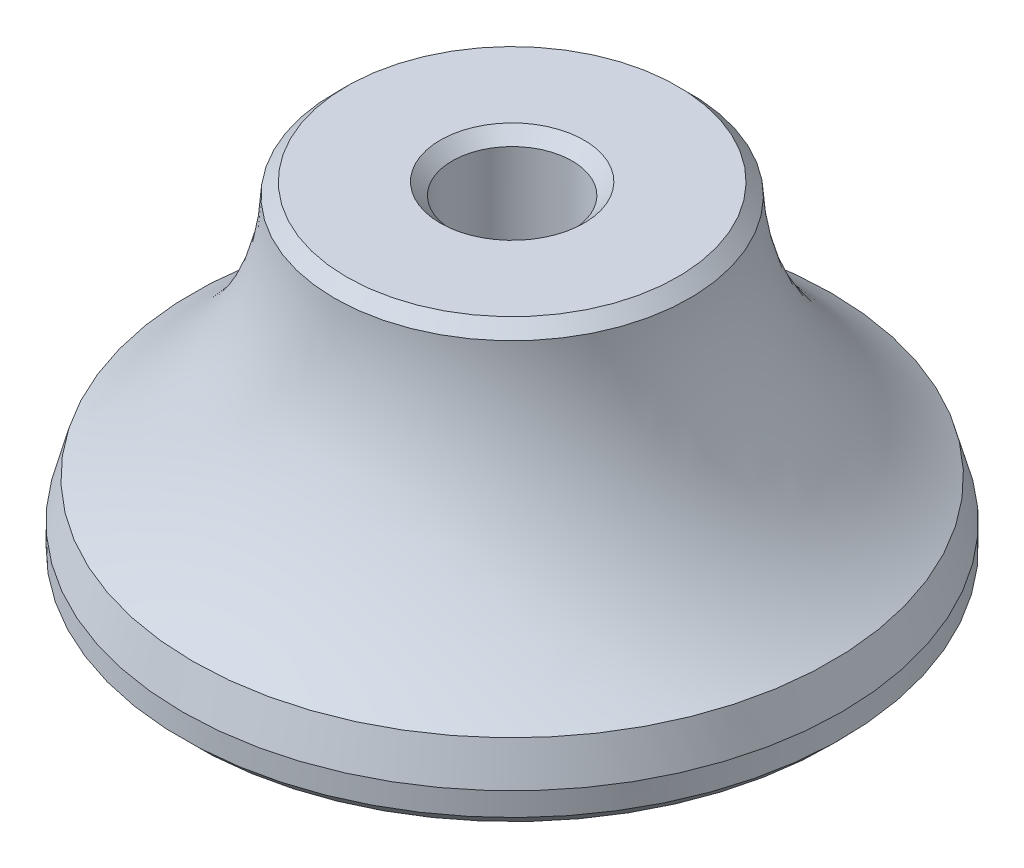
from build123d import *

# Parameters (mm, degrees)
CUT_EXTRUDE1_DEPTH      = 31.245937227
CUT_EXTRUDE1_DEPTH_BACK = 31.245937227
SKETCH2_R               = 3.175
CHAMFER1_SIZE           = 0.635
CHAMFER1_SIZE_2         = 1.705739105


with BuildPart() as part:
    # Sketch1 → Revolve1 (revolve)
    with BuildSketch(Plane.XY, mode=Mode.PRIVATE) as revolve1_sk:
        with BuildLine():
            Line((17.4625, -17.4625), (17.4625, -13.894606786))
            ThreePointArc((17.4625, -13.894606786), (11.560204499, -8.032687253), (9.398, 0))
            Line((9.398, 0), (0, 0))
            Line((0, 0), (0, -17.4625))
            Line((0, -17.4625), (17.4625, -17.4625))
        make_face()
    revolve(revolve1_sk.sketch.rotate(Axis((0, 0, 0), (0, 1, 0)), 90), axis=Axis((0, 0, 0), (0, 1, 0)))

    # Sketch2 → Cut-Extrude1 (cut, two sides: drawn at the far end of the back side and taken through both)
    with BuildSketch(Plane(origin=(0, 0, 0), x_dir=(1, 0, 0), z_dir=(0, 1, 0)).offset(-CUT_EXTRUDE1_DEPTH_BACK)):
        with Locations(Location((0, 0, 0), (0, 0, 270))):
            Circle(SKETCH2_R)
    extrude(amount=CUT_EXTRUDE1_DEPTH + CUT_EXTRUDE1_DEPTH_BACK, mode=Mode.SUBTRACT)

    # Chamfer1
    # the kernel refuses this chamfer: 1.705739105, 0.635 mm, written as the material it takes off along each edge
    with BuildSketch(Plane(origin=(0, 0, 0), x_dir=(0, 0, 1), z_dir=(-1, 0, 0))) as chamfer1_piece_1:
        Polygon((3.175, -CHAMFER1_SIZE), (3.175 + CHAMFER1_SIZE, 0), (3.175, 0), align=None)
    revolve(axis=Axis((0, 0, 0), (0, 1, 0)), mode=Mode.SUBTRACT)
    with BuildSketch(Plane(origin=(0, -17.4625, 0), x_dir=(0, 0, 1), z_dir=(-1, 0, 0))) as chamfer1_piece_2:
        Polygon((3.175 + CHAMFER1_SIZE, 0), (3.175, CHAMFER1_SIZE), (3.175, 0), align=None)
    revolve(axis=Axis((0, -17.4625, 0), (0, 1, 0)), mode=Mode.SUBTRACT)
    with BuildSketch(Plane(origin=(0, -17.4625, 0), x_dir=(0, 0, -1), z_dir=(1, 0, 0))) as chamfer1_piece_3:
        Polygon((17.4625, CHAMFER1_SIZE), (17.4625 - CHAMFER1_SIZE, 0), (17.4625, 0), align=None)
    revolve(axis=Axis((0, -17.4625, 0), (0, 1, 0)), mode=Mode.SUBTRACT)
    with BuildSketch(Plane(origin=(0, 0, 0), x_dir=(0, 0, -1), z_dir=(1, 0, 0))) as chamfer1_piece_4:
        with BuildLine():
            Line((9.411131055, -0.648131055), (9.398 - CHAMFER1_SIZE, 0))
            Line((9.398 - CHAMFER1_SIZE, 0), (9.398, 0))
            ThreePointArc((9.398, 0), (9.401471415, -0.333297329), (9.411131055, -0.648131055))
        make_face()
    revolve(axis=Axis((0, 0, 0), (0, 1, 0)), mode=Mode.SUBTRACT)
    with BuildSketch(Plane(origin=(0, -13.894606786, 0), x_dir=(0, 0, -1), z_dir=(1, 0, 0))) as chamfer1_piece_5:
        with BuildLine():
            Line((17.4625, -CHAMFER1_SIZE_2), (16.906238382, 0.332895332))
            ThreePointArc((16.906238382, 0.332895332), (17.161543174, 0.176303935), (17.4625, 0))
            Line((17.4625, 0), (17.4625, -CHAMFER1_SIZE_2))
        make_face()
    revolve(axis=Axis((0, -13.894606786, 0), (0, 1, 0)), mode=Mode.SUBTRACT)


solid = part.part
